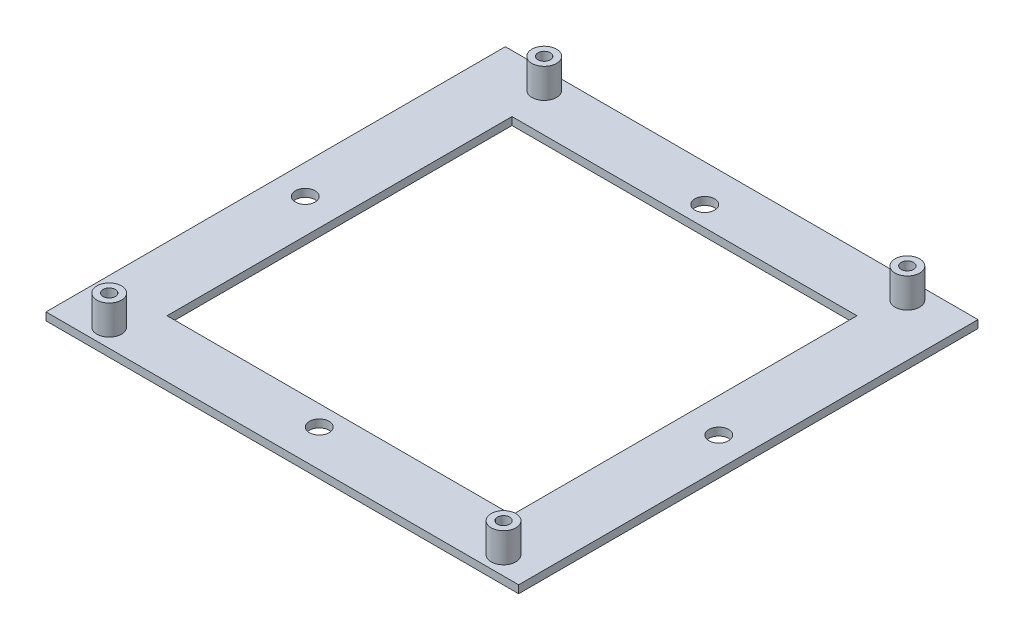
from build123d import *

# Parameters (mm, degrees)
SKETCH1_W                 = 95.9
SKETCH1_H                 = 93.2
SKETCH1_R                 = 2
SKETCH1_W_2               = 70
SKETCH1_H_2               = 70
BOSS_EXTRUDE1_DEPTH       = 1.58
SKETCH2_R                 = 2.5
BOSS_EXTRUDE2_DEPTH       = 6
M3X0_5_TAPPED_HOLE2_D     = 2.5
M3X0_5_TAPPED_HOLE2_DEPTH = 6
M3X0_5_TAPPED_HOLE2_TIP   = 0.751075774


with BuildPart() as part:
    # Sketch1 → Boss-Extrude1 (new body)
    with BuildSketch(Plane(origin=(0, 0, 0), x_dir=(1, 0, 0), z_dir=(0, 1, 0))):
        Rectangle(SKETCH1_W, SKETCH1_H)
        with Locations((0, 39.1)):
            Circle(SKETCH1_R, mode=Mode.SUBTRACT)
        with Locations((41.95, 0)):
            Circle(SKETCH1_R, mode=Mode.SUBTRACT)
        with Locations((0, -39.1)):
            Circle(SKETCH1_R, mode=Mode.SUBTRACT)
        with Locations((-41.95, 0)):
            Circle(SKETCH1_R, mode=Mode.SUBTRACT)
        Rectangle(SKETCH1_W_2, SKETCH1_H_2, mode=Mode.SUBTRACT)
    extrude(amount=BOSS_EXTRUDE1_DEPTH)

    # Sketch2 → Boss-Extrude2 (add)
    with BuildSketch(Plane(origin=(0, 1.58, 0), x_dir=(1, 0, 0), z_dir=(0, 1, 0))):
        with Locations((37.355, 42.8635)):
            Circle(SKETCH2_R)
        with Locations((-36.325, 42.8625)):
            Circle(SKETCH2_R)
        with Locations((-38.865, -42.8625)):
            Circle(SKETCH2_R)
        with Locations((41.145, -42.8625)):
            Circle(SKETCH2_R)
    extrude(amount=BOSS_EXTRUDE2_DEPTH)

    # M3x0.5 Tapped Hole2
    with Locations(Plane(origin=(-36.325, 7.58, -42.8625), x_dir=(0, 0, 1), z_dir=(0, 1, 0))):
        with Locations((0, 0), (85.725, -2.54), (85.725, 77.47), (-0.001, 73.68)):
            Hole(M3X0_5_TAPPED_HOLE2_D / 2, depth=M3X0_5_TAPPED_HOLE2_DEPTH)
            with Locations((0, 0, -(M3X0_5_TAPPED_HOLE2_DEPTH + M3X0_5_TAPPED_HOLE2_TIP / 2))):  # 118° drill point
                Cone(0, M3X0_5_TAPPED_HOLE2_D / 2, M3X0_5_TAPPED_HOLE2_TIP, mode=Mode.SUBTRACT)


solid = part.part
